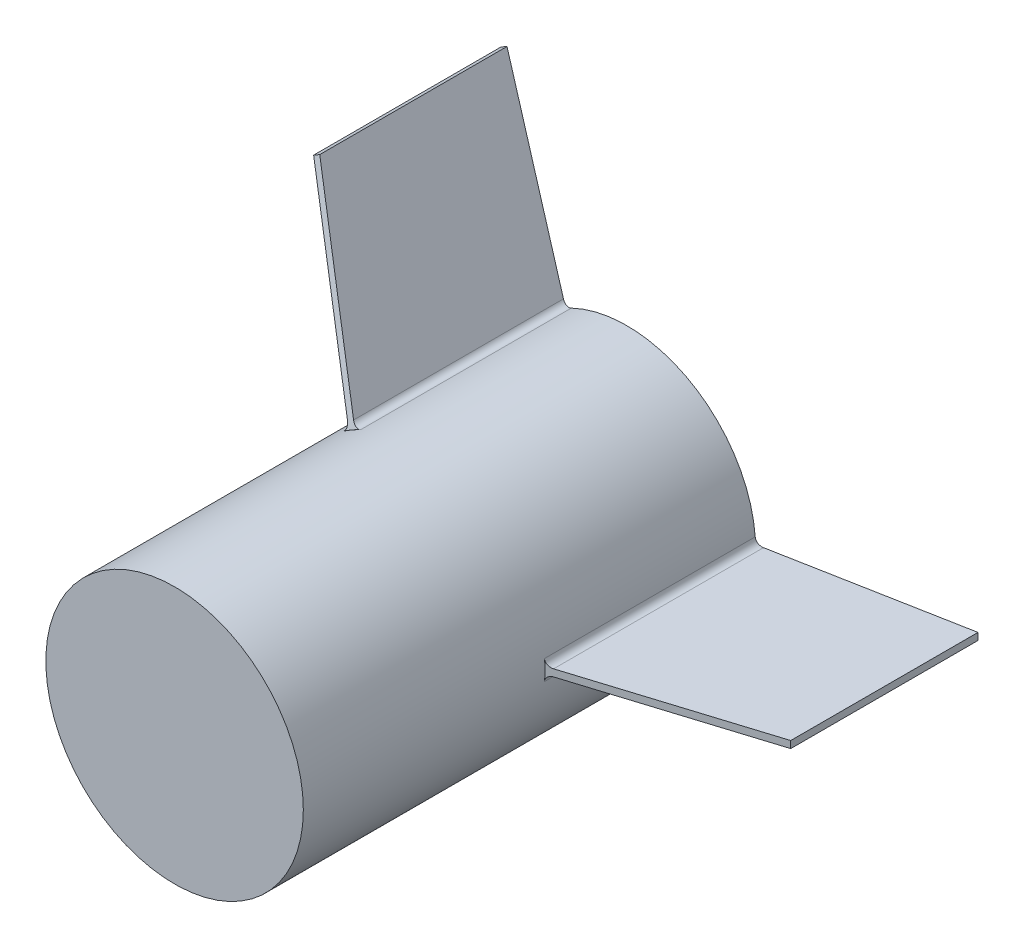
from build123d import *

# Parameters (mm, degrees)
SKETCH_1_R               = 55
EXTRUDE_1_DEPTH          = 190
SKETCH_2_R               = 51.8
CUT_EXTRUDE_1_DEPTH      = 186.8
SKETCH_3_R               = 15
CUT_EXTRUDE_2_DEPTH      = 10
SKETCH_4_R               = 18.2
SKETCH_4_R_2             = 15
EXTRUDE_2_DEPTH          = 188
SKETCH_5_R               = 55
EXTRUDE_5_DEPTH          = 3.2
EXTRUDE_6_DEPTH          = 1.5
PATTERN_CIRCULAR_1_COUNT = 3
FILLET_1_R               = 3


with BuildPart() as part:
    # 草图1 → 凸台-拉伸1 (new body)
    with BuildSketch(Plane.XY):
        Circle(SKETCH_1_R)
    extrude(amount=EXTRUDE_1_DEPTH)

    # 草图2 → 切除-拉伸1 (cut)
    with BuildSketch(Plane.XY.offset(190)):
        Circle(SKETCH_2_R)
    extrude(amount=-CUT_EXTRUDE_1_DEPTH, mode=Mode.SUBTRACT)

    # 草图3 → 切除-拉伸2 (cut)
    with BuildSketch(Plane(origin=(0, 0, 0), x_dir=(-1, 0, 0), z_dir=(0, 0, -1))):
        Circle(SKETCH_3_R)
    extrude(amount=-CUT_EXTRUDE_2_DEPTH, mode=Mode.SUBTRACT)

    # 草图4 → 凸台-拉伸2 (add)
    with BuildSketch(Plane.XY.offset(3.2)):
        Circle(SKETCH_4_R)
        with Locations(Location((0, 0, 0), (0, 0, 180))):
            Circle(SKETCH_4_R_2, mode=Mode.SUBTRACT)
    extrude(amount=EXTRUDE_2_DEPTH)

    # 草图5 → 凸台-拉伸5 (add)
    with BuildSketch(Plane.XY.offset(190)):
        Circle(SKETCH_5_R)
    extrude(amount=EXTRUDE_5_DEPTH)

    # 草图8 → 凸台-拉伸6 (add, symmetric)
    with BuildSketch(Plane(origin=(0, 0, 0), x_dir=(-1, 0, 0), z_dir=(0, 1, 0))):
        Polygon((-55, 90), (-135, 65), (-135, -15), (-55, 0), (-53, 0), (-53, 90), align=None)
    extrude_6 = extrude(amount=EXTRUDE_6_DEPTH, both=True)

    # 阵列(圆周)1: 凸台-拉伸6 ×3 about axis
    pattern_circular_1_axis = Axis((0, 0, 0), (0, 0, 1))
    for i in range(1, PATTERN_CIRCULAR_1_COUNT):
        add(extrude_6.rotate(pattern_circular_1_axis, i * 360 / PATTERN_CIRCULAR_1_COUNT))

    # 圆角1
    # the kernel refuses this fillet: 3 mm, written as the material it adds along each edge
    with BuildSketch(Plane(origin=(-28.78880893, -46.863679757, 90), x_dir=(-0.5000000000000001, -0.8660254037844386, 0), z_dir=(0, 0, -1))) as fillet_1_piece_1_section:
        with BuildLine():
            CenterArc((2.845625882, 3), FILLET_1_R, 184.449834226, 85.550165774)
            ThreePointArc((-0.14533106, 2.767241379), (-0.055235086, 1.384536108), (0, 0))
            Line((0, 0), (2.845625882, 0))
        make_face()
    fillet_1_piece_1 = extrude(amount=90, mode=Mode.PRIVATE)
    fillet_1_piece_1 = split(fillet_1_piece_1, bisect_by=Plane(origin=(-36.031072916, -58.160902251, 85.817388964), z_dir=(0.14913749656797354, 0.25831372136935893, -0.9544799780350298)), keep=Keep.TOP, mode=Mode.PRIVATE)
    fillet_1_piece_1 = split(fillet_1_piece_1, bisect_by=Plane(origin=(-25.561501862, -40.027073251, 1.416522524), z_dir=(-0.09214426752509275, -0.15959855297967937, 0.982872186934322)), keep=Keep.TOP, mode=Mode.PRIVATE)
    add(fillet_1_piece_1)
    with BuildSketch(Plane(origin=(-28.78880893, -46.863679757, 90), x_dir=(-0.5000000000000001, -0.8660254037844386, 0), z_dir=(0, 0, -1))) as fillet_1_piece_2_section:
        with BuildLine():
            CenterArc((2.845625882, 3), FILLET_1_R, 184.449834226, 85.550165774)
            ThreePointArc((-0.14533106, 2.767241379), (-0.055235086, 1.384536108), (0, 0))
            Line((0, 0), (2.845625882, 0))
        make_face()
    fillet_1_piece_2 = extrude(amount=90, mode=Mode.PRIVATE)
    fillet_1_piece_2 = split(fillet_1_piece_2, bisect_by=Plane(origin=(-30.206894917, -45.938881036, 0.021058977), z_dir=(0.09214426752509275, 0.15959855297967937, -0.982872186934322)), keep=Keep.TOP, mode=Mode.PRIVATE)
    add(fillet_1_piece_2)
    with BuildSketch(Plane(origin=(-28.78880893, -46.863679757, 90), x_dir=(-0.5000000000000001, -0.8660254037844386, 0), z_dir=(0, 0, -1))) as fillet_1_piece_3_section:
        with BuildLine():
            CenterArc((2.845625882, 3), FILLET_1_R, 184.449834226, 85.550165774)
            ThreePointArc((-0.14533106, 2.767241379), (-0.055235086, 1.384536108), (0, 0))
            Line((0, 0), (2.845625882, 0))
        make_face()
    fillet_1_piece_3 = extrude(amount=97.114064704, mode=Mode.PRIVATE)
    fillet_1_piece_3 = split(fillet_1_piece_3, bisect_by=Plane(origin=(-29.644971354, -47.826469744, 0), z_dir=(0, 0, -1)), keep=Keep.TOP, mode=Mode.PRIVATE)
    fillet_1_piece_3 = split(fillet_1_piece_3, bisect_by=Plane(origin=(-29.634430967, -47.808213257, -0.228814251), z_dir=(-0.09214426752509275, -0.15959855297967937, 0.982872186934322)), keep=Keep.TOP, mode=Mode.PRIVATE)
    add(fillet_1_piece_3)
    with BuildSketch(Plane(origin=(-26.190732719, -48.363679757, 90), x_dir=(-0.5000000000000023, -0.8660254037844373, 0), z_dir=(0, 0, -1))) as fillet_1_piece_4_section:
        with BuildLine():
            CenterArc((2.845625882, -3), FILLET_1_R, 90, 85.550165774)
            ThreePointArc((-0.14533106, -2.767241379), (-0.055235086, -1.384536108), (0, 0))
            Line((0, 0), (2.845625882, 0))
        make_face()
    fillet_1_piece_4 = extrude(amount=90, mode=Mode.PRIVATE)
    fillet_1_piece_4 = split(fillet_1_piece_4, bisect_by=Plane(origin=(-21.883711344, -42.150446597, 1.416522524), z_dir=(-0.09214426752509275, -0.15959855297967937, 0.982872186934322)), keep=Keep.TOP, mode=Mode.PRIVATE)
    fillet_1_piece_4 = split(fillet_1_piece_4, bisect_by=Plane(origin=(-32.353282398, -60.284275597, 85.817388964), z_dir=(0.14913749656797354, 0.25831372136935893, -0.9544799780350298)), keep=Keep.TOP, mode=Mode.PRIVATE)
    add(fillet_1_piece_4)
    with BuildSketch(Plane(origin=(-26.190732719, -48.363679757, 90), x_dir=(-0.5000000000000023, -0.8660254037844373, 0), z_dir=(0, 0, -1))) as fillet_1_piece_5_section:
        with BuildLine():
            CenterArc((2.845625882, -3), FILLET_1_R, 90, 85.550165774)
            ThreePointArc((-0.14533106, -2.767241379), (-0.055235086, -1.384536108), (0, 0))
            Line((0, 0), (2.845625882, 0))
        make_face()
    fillet_1_piece_5 = extrude(amount=90, mode=Mode.PRIVATE)
    fillet_1_piece_5 = split(fillet_1_piece_5, bisect_by=Plane(origin=(-24.68079054, -49.129378886, 0.021058977), z_dir=(0.09214426752509275, 0.15959855297967937, -0.982872186934322)), keep=Keep.TOP, mode=Mode.PRIVATE)
    add(fillet_1_piece_5)
    with BuildSketch(Plane(origin=(-26.190732719, -48.363679757, 90), x_dir=(-0.5000000000000023, -0.8660254037844373, 0), z_dir=(0, 0, -1))) as fillet_1_piece_6_section:
        with BuildLine():
            CenterArc((2.845625882, -3), FILLET_1_R, 90, 85.550165774)
            ThreePointArc((-0.14533106, -2.767241379), (-0.055235086, -1.384536108), (0, 0))
            Line((0, 0), (2.845625882, 0))
        make_face()
    fillet_1_piece_6 = extrude(amount=97.114064704, mode=Mode.PRIVATE)
    fillet_1_piece_6 = split(fillet_1_piece_6, bisect_by=Plane(origin=(-26.596452095, -49.58653316, 0), z_dir=(0, 0, -1)), keep=Keep.TOP, mode=Mode.PRIVATE)
    fillet_1_piece_6 = split(fillet_1_piece_6, bisect_by=Plane(origin=(-26.585911707, -49.568276672, -0.228814251), z_dir=(-0.09214426752509275, -0.15959855297967937, 0.982872186934322)), keep=Keep.TOP, mode=Mode.PRIVATE)
    add(fillet_1_piece_6)
    with BuildSketch(Plane(origin=(54.97954165, -1.5, 90), x_dir=(1, 0, 0), z_dir=(0, 0, -1))) as fillet_1_piece_7_section:
        with BuildLine():
            CenterArc((2.845625882, 3), FILLET_1_R, 184.449834226, 85.550165774)
            ThreePointArc((-0.14533106, 2.767241379), (-0.055235086, 1.384536108), (0, 0))
            Line((0, 0), (2.845625882, 0))
        make_face()
    fillet_1_piece_7 = extrude(amount=90, mode=Mode.PRIVATE)
    fillet_1_piece_7 = split(fillet_1_piece_7, bisect_by=Plane(origin=(47.445213206, -2.123373346, 1.416522524), z_dir=(0.1842885350501853, 0, 0.9828721869343219)), keep=Keep.TOP, mode=Mode.PRIVATE)
    fillet_1_piece_7 = split(fillet_1_piece_7, bisect_by=Plane(origin=(68.384355315, -2.123373346, 85.817388964), z_dir=(-0.2982749931359468, 0, -0.9544799780350298)), keep=Keep.TOP, mode=Mode.PRIVATE)
    add(fillet_1_piece_7)
    with BuildSketch(Plane(origin=(54.97954165, -1.5, 90), x_dir=(1, 0, 0), z_dir=(0, 0, -1))) as fillet_1_piece_8_section:
        with BuildLine():
            CenterArc((2.845625882, 3), FILLET_1_R, 184.449834226, 85.550165774)
            ThreePointArc((-0.14533106, 2.767241379), (-0.055235086, 1.384536108), (0, 0))
            Line((0, 0), (2.845625882, 0))
        make_face()
    fillet_1_piece_8 = extrude(amount=90, mode=Mode.PRIVATE)
    fillet_1_piece_8 = split(fillet_1_piece_8, bisect_by=Plane(origin=(54.887685457, -3.19049785, 0.021058977), z_dir=(-0.1842885350501853, 0, -0.9828721869343219)), keep=Keep.TOP, mode=Mode.PRIVATE)
    add(fillet_1_piece_8)
    with BuildSketch(Plane(origin=(54.97954165, -1.5, 90), x_dir=(1, 0, 0), z_dir=(0, 0, -1))) as fillet_1_piece_9_section:
        with BuildLine():
            CenterArc((2.845625882, 3), FILLET_1_R, 184.449834226, 85.550165774)
            ThreePointArc((-0.14533106, 2.767241379), (-0.055235086, 1.384536108), (0, 0))
            Line((0, 0), (2.845625882, 0))
        make_face()
    fillet_1_piece_9 = extrude(amount=97.114064704, mode=Mode.PRIVATE)
    fillet_1_piece_9 = split(fillet_1_piece_9, bisect_by=Plane(origin=(56.241423449, -1.760063415, 0), z_dir=(0, 0, -1)), keep=Keep.TOP, mode=Mode.PRIVATE)
    fillet_1_piece_9 = split(fillet_1_piece_9, bisect_by=Plane(origin=(56.220342674, -1.760063415, -0.228814251), z_dir=(0.1842885350501853, 0, 0.9828721869343219)), keep=Keep.TOP, mode=Mode.PRIVATE)
    add(fillet_1_piece_9)
    with BuildSketch(Plane(origin=(54.97954165, 1.5, 90), x_dir=(-0.052446111063003654, 0.9986237556929872, 0), z_dir=(0, 0, -1))) as fillet_1_piece_10_section:
        with BuildLine():
            CenterArc((2.846629256, 2.999047938), FILLET_1_R, 183.006320086, 85.550165774)
            Line((-0.149242011, 2.841709605), (0, 0))
            ThreePointArc((0, 0), (1.385527514, 0.017454465), (2.771055028, 0))
        make_face()
    fillet_1_piece_10 = extrude(amount=90, mode=Mode.PRIVATE)
    fillet_1_piece_10 = split(fillet_1_piece_10, bisect_by=Plane(origin=(68.384355315, 2.123373346, 85.817388964), z_dir=(-0.2982749931359468, 0, -0.9544799780350298)), keep=Keep.TOP, mode=Mode.PRIVATE)
    fillet_1_piece_10 = split(fillet_1_piece_10, bisect_by=Plane(origin=(47.445213206, 2.123373346, 1.416522524), z_dir=(0.1842885350501853, 0, 0.9828721869343219)), keep=Keep.TOP, mode=Mode.PRIVATE)
    add(fillet_1_piece_10)
    with BuildSketch(Plane(origin=(54.97954165, 1.5, 90), x_dir=(-0.052446111063003654, 0.9986237556929872, 0), z_dir=(0, 0, -1))) as fillet_1_piece_11_section:
        with BuildLine():
            CenterArc((2.846629256, 2.999047938), FILLET_1_R, 183.006320086, 85.550165774)
            Line((-0.149242011, 2.841709605), (0, 0))
            ThreePointArc((0, 0), (1.385527514, 0.017454465), (2.771055028, 0))
        make_face()
    fillet_1_piece_11 = extrude(amount=97.114064704, mode=Mode.PRIVATE)
    fillet_1_piece_11 = split(fillet_1_piece_11, bisect_by=Plane(origin=(56.241423446, 1.760063423, 0), z_dir=(0, 0, -1)), keep=Keep.TOP, mode=Mode.PRIVATE)
    fillet_1_piece_11 = split(fillet_1_piece_11, bisect_by=Plane(origin=(56.220342671, 1.760063423, -0.228814251), z_dir=(0.1842885350501853, 0, 0.9828721869343219)), keep=Keep.TOP, mode=Mode.PRIVATE)
    add(fillet_1_piece_11)
    with BuildSketch(Plane(origin=(54.97954165, 1.5, 90), x_dir=(-0.052446111063003654, 0.9986237556929872, 0), z_dir=(0, 0, -1))) as fillet_1_piece_12_section:
        with BuildLine():
            CenterArc((2.846629256, 2.999047938), FILLET_1_R, 183.006320086, 85.550165774)
            Line((-0.149242011, 2.841709605), (0, 0))
            ThreePointArc((0, 0), (1.385527514, 0.017454465), (2.771055028, 0))
        make_face()
    fillet_1_piece_12 = extrude(amount=90, mode=Mode.PRIVATE)
    fillet_1_piece_12 = split(fillet_1_piece_12, bisect_by=Plane(origin=(54.887685455, 3.190497829, 0.021058977), z_dir=(-0.1842885350501853, 0, -0.9828721869343219)), keep=Keep.TOP, mode=Mode.PRIVATE)
    add(fillet_1_piece_12)
    with BuildSketch(Plane(origin=(-26.190732719, 48.363679757, 90), x_dir=(-0.5000000000000009, 0.866025403784438, 0), z_dir=(0, 0, -1))) as fillet_1_piece_13_section:
        with BuildLine():
            CenterArc((2.845625882, 3), FILLET_1_R, 184.449834226, 85.550165774)
            ThreePointArc((-0.14533106, 2.767241379), (-0.055235086, 1.384536108), (0, 0))
            Line((0, 0), (2.845625882, 0))
        make_face()
    fillet_1_piece_13 = extrude(amount=90, mode=Mode.PRIVATE)
    fillet_1_piece_13 = split(fillet_1_piece_13, bisect_by=Plane(origin=(-32.353282398, 60.284275597, 85.817388964), z_dir=(0.14913749656797334, -0.25831372136935904, -0.9544799780350298)), keep=Keep.TOP, mode=Mode.PRIVATE)
    fillet_1_piece_13 = split(fillet_1_piece_13, bisect_by=Plane(origin=(-21.883711344, 42.150446597, 1.416522524), z_dir=(-0.09214426752509264, 0.15959855297967945, 0.982872186934322)), keep=Keep.TOP, mode=Mode.PRIVATE)
    add(fillet_1_piece_13)
    with BuildSketch(Plane(origin=(-26.190732719, 48.363679757, 90), x_dir=(-0.5000000000000009, 0.866025403784438, 0), z_dir=(0, 0, -1))) as fillet_1_piece_14_section:
        with BuildLine():
            CenterArc((2.845625882, 3), FILLET_1_R, 184.449834226, 85.550165774)
            ThreePointArc((-0.14533106, 2.767241379), (-0.055235086, 1.384536108), (0, 0))
            Line((0, 0), (2.845625882, 0))
        make_face()
    fillet_1_piece_14 = extrude(amount=90, mode=Mode.PRIVATE)
    fillet_1_piece_14 = split(fillet_1_piece_14, bisect_by=Plane(origin=(-24.68079054, 49.129378886, 0.021058977), z_dir=(0.09214426752509264, -0.15959855297967945, -0.982872186934322)), keep=Keep.TOP, mode=Mode.PRIVATE)
    add(fillet_1_piece_14)
    with BuildSketch(Plane(origin=(-26.190732719, 48.363679757, 90), x_dir=(-0.5000000000000009, 0.866025403784438, 0), z_dir=(0, 0, -1))) as fillet_1_piece_15_section:
        with BuildLine():
            CenterArc((2.845625882, 3), FILLET_1_R, 184.449834226, 85.550165774)
            ThreePointArc((-0.14533106, 2.767241379), (-0.055235086, 1.384536108), (0, 0))
            Line((0, 0), (2.845625882, 0))
        make_face()
    fillet_1_piece_15 = extrude(amount=97.114064704, mode=Mode.PRIVATE)
    fillet_1_piece_15 = split(fillet_1_piece_15, bisect_by=Plane(origin=(-26.596452095, 49.58653316, 0), z_dir=(0, 0, -1)), keep=Keep.TOP, mode=Mode.PRIVATE)
    fillet_1_piece_15 = split(fillet_1_piece_15, bisect_by=Plane(origin=(-26.585911707, 49.568276672, -0.228814251), z_dir=(-0.09214426752509264, 0.15959855297967945, 0.982872186934322)), keep=Keep.TOP, mode=Mode.PRIVATE)
    add(fillet_1_piece_15)
    with BuildSketch(Plane(origin=(-28.78880893, 46.863679757, 90), x_dir=(-0.5000000000000001, 0.8660254037844386, 0), z_dir=(0, 0, -1))) as fillet_1_piece_16_section:
        with BuildLine():
            CenterArc((2.845625882, -3), FILLET_1_R, 90, 85.550165774)
            ThreePointArc((-0.14533106, -2.767241379), (-0.055235086, -1.384536108), (0, 0))
            Line((0, 0), (2.845625882, 0))
        make_face()
    fillet_1_piece_16 = extrude(amount=90, mode=Mode.PRIVATE)
    fillet_1_piece_16 = split(fillet_1_piece_16, bisect_by=Plane(origin=(-25.561501862, 40.027073251, 1.416522524), z_dir=(-0.09214426752509264, 0.15959855297967945, 0.982872186934322)), keep=Keep.TOP, mode=Mode.PRIVATE)
    fillet_1_piece_16 = split(fillet_1_piece_16, bisect_by=Plane(origin=(-36.031072916, 58.160902251, 85.817388964), z_dir=(0.14913749656797334, -0.25831372136935904, -0.9544799780350298)), keep=Keep.TOP, mode=Mode.PRIVATE)
    add(fillet_1_piece_16)
    with BuildSketch(Plane(origin=(-28.78880893, 46.863679757, 90), x_dir=(-0.5000000000000001, 0.8660254037844386, 0), z_dir=(0, 0, -1))) as fillet_1_piece_17_section:
        with BuildLine():
            CenterArc((2.845625882, -3), FILLET_1_R, 90, 85.550165774)
            ThreePointArc((-0.14533106, -2.767241379), (-0.055235086, -1.384536108), (0, 0))
            Line((0, 0), (2.845625882, 0))
        make_face()
    fillet_1_piece_17 = extrude(amount=90, mode=Mode.PRIVATE)
    fillet_1_piece_17 = split(fillet_1_piece_17, bisect_by=Plane(origin=(-30.206894917, 45.938881036, 0.021058977), z_dir=(0.09214426752509264, -0.15959855297967945, -0.982872186934322)), keep=Keep.TOP, mode=Mode.PRIVATE)
    add(fillet_1_piece_17)
    with BuildSketch(Plane(origin=(-28.78880893, 46.863679757, 90), x_dir=(-0.5000000000000001, 0.8660254037844386, 0), z_dir=(0, 0, -1))) as fillet_1_piece_18_section:
        with BuildLine():
            CenterArc((2.845625882, -3), FILLET_1_R, 90, 85.550165774)
            ThreePointArc((-0.14533106, -2.767241379), (-0.055235086, -1.384536108), (0, 0))
            Line((0, 0), (2.845625882, 0))
        make_face()
    fillet_1_piece_18 = extrude(amount=97.114064704, mode=Mode.PRIVATE)
    fillet_1_piece_18 = split(fillet_1_piece_18, bisect_by=Plane(origin=(-29.644971354, 47.826469744, 0), z_dir=(0, 0, -1)), keep=Keep.TOP, mode=Mode.PRIVATE)
    fillet_1_piece_18 = split(fillet_1_piece_18, bisect_by=Plane(origin=(-29.634430967, 47.808213257, -0.228814251), z_dir=(-0.09214426752509264, 0.15959855297967945, 0.982872186934322)), keep=Keep.TOP, mode=Mode.PRIVATE)
    add(fillet_1_piece_18)


solid = part.part
